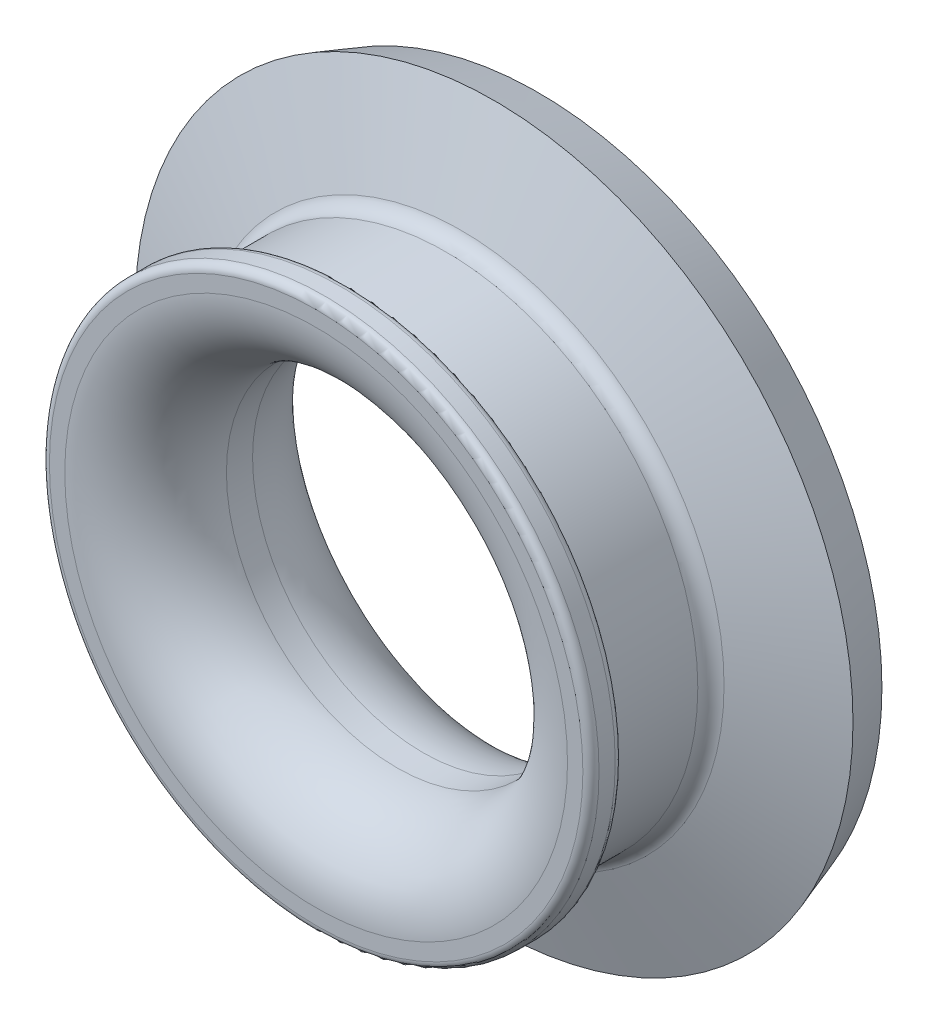
from build123d import *


with BuildPart() as part:
    # Sketch1 → Revolve1 (revolve)
    with BuildSketch(Plane(origin=(0, 0, 0), x_dir=(0, 0, -1), z_dir=(1, 0, 0))):
        with BuildLine():
            Line((0, 33), (0, 31.1))
            ThreePointArc((0, 31.1), (2.928932188, 24.028932188), (10, 21.1))
            Line((10, 21.1), (13.233881182, 21.1))
            ThreePointArc((13.233881182, 21.1), (20.785725875, 23.774248463), (24.971652391, 30.60505971))
            Line((24.971652391, 30.60505971), (27.5, 42.5))
            Line((27.5, 42.5), (22.020036496, 44.4))
            Line((22.020036496, 44.4), (17.961988444, 32.504269348))
            ThreePointArc((17.961988444, 32.504269348), (17.232829398, 31.523429789), (16.069098609, 31.15))
            Line((16.069098609, 31.15), (5, 31.15))
            ThreePointArc((5, 31.15), (4.292893219, 31.442893219), (4, 32.15))
            Line((4, 32.15), (4, 33))
            ThreePointArc((4, 33), (3.707106781, 33.707106781), (3, 34))
            Line((3, 34), (1, 34))
            ThreePointArc((1, 34), (0.292893219, 33.707106781), (0, 33))
        make_face()
    revolve(axis=Axis((0, 0, 0), (0, 0, -1)))


solid = part.part
